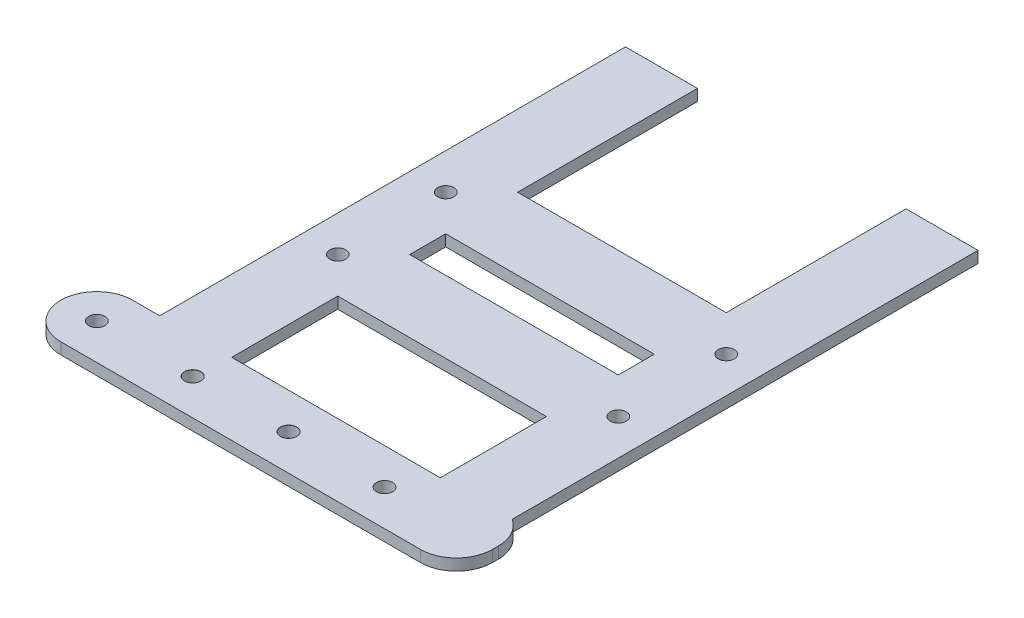
from build123d import *

# Parameters (mm, degrees)
SKETCH1_W                     = 100
SKETCH1_H                     = 400
BOSS_EXTRUDE1_DEPTH           = 3.175
M4_CLEARANCE_HOLE2_D          = 4.5
SKETCH7_W                     = 400
SKETCH7_H                     = 3.175
BOSS_EXTRUDE2_DEPTH           = 20
M4_CLEARANCE_HOLE1_D          = 4.5
SKETCH13_W                    = 17.5
SKETCH13_H                    = 265
SKETCH13_W_2                  = 58
SKETCH13_H_2                  = 69.5
SKETCH13_W_3                  = 4.5
SKETCH13_H_3                  = 66
SKETCH13_H_4                  = 10
SKETCH13_H_5                  = 29.5
SKETCH13_H_6                  = 75
CUT_EXTRUDE1_DEPTH            = 3.175
FILLET1_R                     = 10
SKETCH14_W                    = 120
SKETCH14_H                    = 250.5
CUT_EXTRUDE2_DEPTH            = 3.175
M4_CLEARANCE_HOLE3_AT_2_COUNT = 2
M4_CLEARANCE_HOLE3_AT_2_PITCH = 26.666666667


with BuildPart() as part:
    # Sketch1 → Boss-Extrude1 (new body)
    with BuildSketch(Plane(origin=(0, 0, 0), x_dir=(1, 0, 0), z_dir=(0, 1, 0))):
        Rectangle(SKETCH1_W, SKETCH1_H)
    extrude(amount=BOSS_EXTRUDE1_DEPTH)

    # M4 Clearance Hole2 (through all)
    with Locations(Plane(origin=(0, 3.175, 0), x_dir=(1, 0, 0), z_dir=(0, 1, 0))):
        with Locations((-40, 190), (40, 190), (40, -190), (-40, -190), (-40, 95), (40, 95)):
            Hole(M4_CLEARANCE_HOLE2_D / 2)

    # Sketch7 → Boss-Extrude2 (add)
    with BuildSketch(Plane(origin=(50, 0, 0), x_dir=(0, 0, -1), z_dir=(1, 0, 0))):
        with Locations((0, 1.5875)):
            Rectangle(SKETCH7_W, SKETCH7_H)
    extrude(amount=BOSS_EXTRUDE2_DEPTH)

    # M4 Clearance Hole1 (through all)
    with Locations(Plane(origin=(0, 3.175, 0), x_dir=(1, 0, 0), z_dir=(0, 1, 0))):
        with Locations((55.5, -140.5), (55.5, -110.5), (-22.5, -110.5), (-22.5, -140.5), (-22.5, -24.5), (-22.5, 5.5), (55.5, 5.5), (55.5, -24.5)):
            Hole(M4_CLEARANCE_HOLE1_D / 2)

    # Sketch13 → Cut-Extrude1 (cut)
    with BuildSketch(Plane(origin=(0, 3.175, 0), x_dir=(1, 0, 0), z_dir=(0, 1, 0))):
        with Locations((-41.25, -47.5)):
            Rectangle(SKETCH13_W, SKETCH13_H)
        with Locations((16.5, 50.25)):
            Rectangle(SKETCH13_W_2, SKETCH13_H_2)
        with Locations((67.75, -47.5)):
            Rectangle(SKETCH13_W_3, SKETCH13_H)
        with Locations((16.5, -67.5)):
            Rectangle(SKETCH13_W_2, SKETCH13_H_3)
        with Locations((16.5, -125.5)):
            Rectangle(SKETCH13_W_2, SKETCH13_H_4)
        with Locations((16.5, -165.25)):
            Rectangle(SKETCH13_W_2, SKETCH13_H_5)
        with Locations((-41.25, 142.5)):
            Rectangle(SKETCH13_W, SKETCH13_H_6)
        with Locations((16.5, 142.5)):
            Rectangle(SKETCH13_W_2, SKETCH13_H_6)
        with Locations((67.75, 142.5)):
            Rectangle(SKETCH13_W_3, SKETCH13_H_6)
        with Locations((16.5, -9.5)):
            Rectangle(SKETCH13_W_2, SKETCH13_H_4)
    extrude(amount=-CUT_EXTRUDE1_DEPTH, mode=Mode.SUBTRACT)

    # Fillet1
    # the kernel refuses this fillet: 10 mm, written as the material it takes off along each edge
    with BuildSketch(Plane(origin=(70, 24.054116361, -180), x_dir=(0, 0, -1), z_dir=(0, -1, 0)), Plane(origin=(70, 24.054116361, -85), x_dir=(0, 0, -1), z_dir=(0, -1, 0))) as fillet1_piece_1:
        with BuildLine():
            CenterArc((8.351646544, -10), FILLET1_R, 90, 56.632987031)
            Line((0, -4.5), (-0.167032931, -4.39))
            ThreePointArc((-0.167032931, -4.39), (-0.2, -2.25), (-0.2, 0))
            Line((-0.2, 0), (0, 0.2))
            Line((0, 0.2), (8.351646544, 0.2))
            Line((8.351646544, 0.2), (8.351646544, 0))
        make_face()
    extrude(amount=44.933232721, mode=Mode.SUBTRACT)
    with BuildSketch(Plane(origin=(70, -25, -200), x_dir=(-1, 0, 0), z_dir=(0, 1, 0)), Plane(origin=(-50, -25, -200), x_dir=(0, 0, 1), z_dir=(0, 1, 0)), Plane(origin=(70, 28.175, 200), x_dir=(-1, 0, 0), z_dir=(0, -1, 0)), Plane(origin=(-50, -25, 200), x_dir=(1, 0, 0), z_dir=(0, 1, 0))) as fillet1_piece_2:
        with BuildLine():
            CenterArc((FILLET1_R, FILLET1_R), FILLET1_R, 180, 90)
            Line((0, FILLET1_R), (-FILLET1_R * 0.02, FILLET1_R))
            Line((-FILLET1_R * 0.02, FILLET1_R), (-FILLET1_R * 0.02, -FILLET1_R * 0.02))
            Line((-FILLET1_R * 0.02, -FILLET1_R * 0.02), (FILLET1_R, -FILLET1_R * 0.02))
            Line((FILLET1_R, -FILLET1_R * 0.02), (FILLET1_R, 0))
        make_face()
    extrude(amount=53.175, mode=Mode.SUBTRACT)
    with BuildSketch(Plane(origin=(-50, 28.175, -180), x_dir=(1, 0, 0), z_dir=(0, -1, 0)), Plane(origin=(-50, 28.175, -85), x_dir=(1, 0, 0), z_dir=(0, -1, 0)), Plane(origin=(-50, 28.175, -105), x_dir=(0, 0, 1), z_dir=(0, -1, 0)), Plane(origin=(-50, 28.175, 180), x_dir=(0, 0, 1), z_dir=(0, -1, 0))) as fillet1_piece_3:
        with BuildLine():
            CenterArc((FILLET1_R, -FILLET1_R), FILLET1_R, 90, 90)
            Line((0, -FILLET1_R), (-FILLET1_R * 0.02, -FILLET1_R))
            Line((-FILLET1_R * 0.02, -FILLET1_R), (-FILLET1_R * 0.02, FILLET1_R * 0.02))
            Line((-FILLET1_R * 0.02, FILLET1_R * 0.02), (FILLET1_R, FILLET1_R * 0.02))
            Line((FILLET1_R, FILLET1_R * 0.02), (FILLET1_R, 0))
        make_face()
    extrude(amount=53.175, mode=Mode.SUBTRACT)
    with BuildSketch(Plane(origin=(70, 24.054116361, -105), x_dir=(-1.0, 0, 1.5347723092402606e-12), z_dir=(0, -1, 0))) as fillet1_piece_4:
        with BuildLine():
            CenterArc((10, -8.351646544), FILLET1_R, 123.367012969, 56.632987031)
            Line((0, -8.351646544), (-0.2, -8.351646544))
            Line((-0.2, -8.351646544), (-0.2, 0))
            Line((-0.2, 0), (0, 0.2))
            ThreePointArc((0, 0.2), (2.25, 0.2), (4.39, 0.167032931))
            Line((4.39, 0.167032931), (4.5, 0))
        make_face()
    extrude(amount=44.933232721, mode=Mode.SUBTRACT)
    with BuildSketch(Plane(origin=(70, 24.054116361, 180), x_dir=(0, 0, 1), z_dir=(0, -1, 0))) as fillet1_piece_5:
        with BuildLine():
            CenterArc((8.351646544, 10), FILLET1_R, 213.367012969, 56.632987031)
            Line((0, 4.5), (-0.167032931, 4.39))
            ThreePointArc((-0.167032931, 4.39), (-0.2, 2.25), (-0.2, 0))
            Line((-0.2, 0), (0, -0.2))
            Line((0, -0.2), (8.351646544, -0.2))
            Line((8.351646544, -0.2), (8.351646544, 0))
        make_face()
    extrude(amount=44.933232721, mode=Mode.SUBTRACT)

    # Sketch14 → Cut-Extrude2 (cut)
    with BuildSketch(Plane(origin=(0, 3.175, 0), x_dir=(1, 0, 0), z_dir=(0, 1, 0))):
        with Locations((10, 74.75)):
            Rectangle(SKETCH14_W, SKETCH14_H)
    extrude(amount=-CUT_EXTRUDE2_DEPTH, mode=Mode.SUBTRACT)

    # Sketch16 → M4 Clearance Hole3 (revolve, cut)
    with BuildSketch(Plane(origin=(13.333333333, 0, 190), x_dir=(0, 0, -1), z_dir=(1, 0, 0))):
        Polygon((0, 0), (0, 3.175), (2.275, 3.175), (2.25, 3.15), (2.25, 0.025), (2.275, 0), align=None)
    m4_clearance_hole3 = revolve(axis=Axis((13.333333333, -6.35, 190), (0, 1, 0)), mode=Mode.SUBTRACT)

    # M4 Clearance Hole3 at 2: M4 Clearance Hole3 ×2
    with Locations(*[(-i * M4_CLEARANCE_HOLE3_AT_2_PITCH, 0, 0) for i in range(1, M4_CLEARANCE_HOLE3_AT_2_COUNT)]):
        add(m4_clearance_hole3, mode=Mode.SUBTRACT)


solid = part.part
